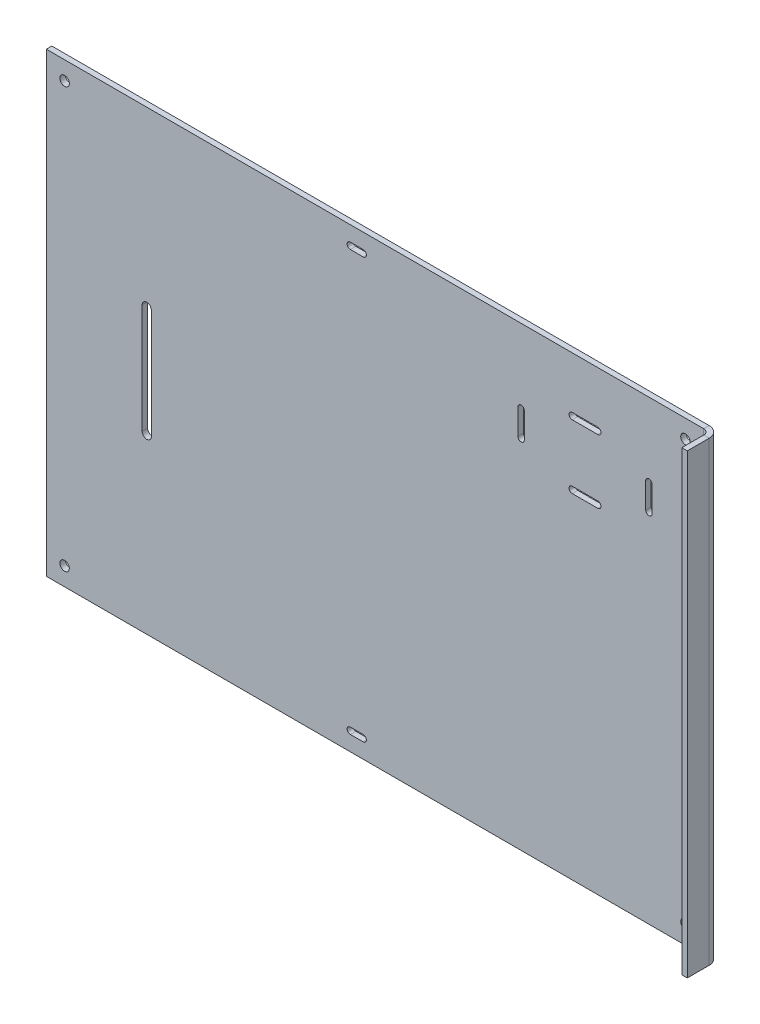
from build123d import *

# Parameters (mm, degrees)
SKETCH1_W                  = 360
SKETCH1_H                  = 250
BASE_FLANGE1_DEPTH         = 3
F_6_0_204_DIAMETER_SLOT1_D = 5.1816
CUT_EXTRUDE1_DEPTH         = 10
CUT_EXTRUDE2_DEPTH         = 10
CUT_EXTRUDE4_DEPTH         = 10
CUT_EXTRUDE5_DEPTH         = 10
CUT_EXTRUDE6_DEPTH         = 10
CUT_EXTRUDE7_DEPTH         = 10
CUT_EXTRUDE8_DEPTH         = 10
EDGE_FLANGE1_DEPTH         = 250


# Sheet-metal steps are written as plain solids
with BuildPart() as part:
    # Sketch1 → Base-Flange1 (new body)
    with BuildSketch(Plane.XY):
        Rectangle(SKETCH1_W, SKETCH1_H)
    extrude(amount=-BASE_FLANGE1_DEPTH)

    # #6 (0.204) Diameter Slot1 (through all)
    with Locations(Plane.XY):
        with Locations((-170, -115), (-170, 115), (170, 115), (170, -115)):
            Hole(F_6_0_204_DIAMETER_SLOT1_D / 2)

    # Sketch8 → Cut-Extrude1 (cut)
    with BuildSketch(Plane.XY):
        with BuildLine():
            Line((-13.5, -113.25), (-6.5, -113.25))
            ThreePointArc((-6.5, -113.25), (-4.75, -115), (-6.5, -116.75))
            Line((-6.5, -116.75), (-13.5, -116.75))
            ThreePointArc((-13.5, -116.75), (-15.25, -115), (-13.5, -113.25))
        make_face()
    extrude(amount=-CUT_EXTRUDE1_DEPTH, mode=Mode.SUBTRACT)

    # Sketch9 → Cut-Extrude2 (cut)
    with BuildSketch(Plane.XY):
        with BuildLine():
            Line((-13.5, 116.75), (-6.5, 116.75))
            ThreePointArc((-6.5, 116.75), (-4.75, 115), (-6.5, 113.25))
            Line((-6.5, 113.25), (-13.5, 113.25))
            ThreePointArc((-13.5, 113.25), (-15.25, 115), (-13.5, 116.75))
        make_face()
    extrude(amount=-CUT_EXTRUDE2_DEPTH, mode=Mode.SUBTRACT)

    # Sketch10 → Cut-Extrude4 (cut)
    with BuildSketch(Plane.XY):
        with BuildLine():
            Line((151.75, 84.5), (151.75, 70.5))
            ThreePointArc((151.75, 70.5), (150, 68.75), (148.25, 70.5))
            Line((148.25, 70.5), (148.25, 84.5))
            ThreePointArc((148.25, 84.5), (150, 86.25), (151.75, 84.5))
        make_face()
    extrude(amount=-CUT_EXTRUDE4_DEPTH, mode=Mode.SUBTRACT)

    # Sketch11 → Cut-Extrude5 (cut)
    with BuildSketch(Plane.XY):
        with BuildLine():
            Line((108, 96.75), (122, 96.75))
            ThreePointArc((122, 96.75), (123.75, 95), (122, 93.25))
            Line((122, 93.25), (108, 93.25))
            ThreePointArc((108, 93.25), (106.25, 95), (108, 96.75))
        make_face()
    extrude(amount=-CUT_EXTRUDE5_DEPTH, mode=Mode.SUBTRACT)

    # Sketch12 → Cut-Extrude6 (cut)
    with BuildSketch(Plane.XY):
        with BuildLine():
            Line((108, 61.75), (122, 61.75))
            ThreePointArc((122, 61.75), (123.75, 60), (122, 58.25))
            Line((122, 58.25), (108, 58.25))
            ThreePointArc((108, 58.25), (106.25, 60), (108, 61.75))
        make_face()
    extrude(amount=-CUT_EXTRUDE6_DEPTH, mode=Mode.SUBTRACT)

    # Sketch13 → Cut-Extrude7 (cut)
    with BuildSketch(Plane.XY):
        with BuildLine():
            Line((81.75, 84.5), (81.75, 70.5))
            ThreePointArc((81.75, 70.5), (80, 68.75), (78.25, 70.5))
            Line((78.25, 70.5), (78.25, 84.5))
            ThreePointArc((78.25, 84.5), (80, 86.25), (81.75, 84.5))
        make_face()
    extrude(amount=-CUT_EXTRUDE7_DEPTH, mode=Mode.SUBTRACT)

    # Sketch14 → Cut-Extrude8 (cut)
    with BuildSketch(Plane.XY):
        with BuildLine():
            Line((-122.5, 30), (-122.5, -30))
            ThreePointArc((-122.5, -30), (-125, -32.5), (-127.5, -30))
            Line((-127.5, -30), (-127.5, 30))
            ThreePointArc((-127.5, 30), (-125, 32.5), (-122.5, 30))
        make_face()
    extrude(amount=-CUT_EXTRUDE8_DEPTH, mode=Mode.SUBTRACT)

    # Edge-Flange1 section (across the edge) → Edge-Flange1 (add)
    with BuildSketch(Plane(origin=(183, -125, 0), x_dir=(-1, 0, 0), z_dir=(0, 1, 0))):
        with BuildLine():
            Line((-3, 3), (-3, 15))
            Line((-3, 15), (0, 15))
            Line((0, 15), (0, 3))
            ThreePointArc((0, 3), (0.878679656, 0.878679656), (3, 0))
            Line((3, 0), (3, -3))
            ThreePointArc((3, -3), (-1.242640687, -1.242640687), (-3, 3))
        make_face()
    extrude(amount=EDGE_FLANGE1_DEPTH)


solid = part.part
